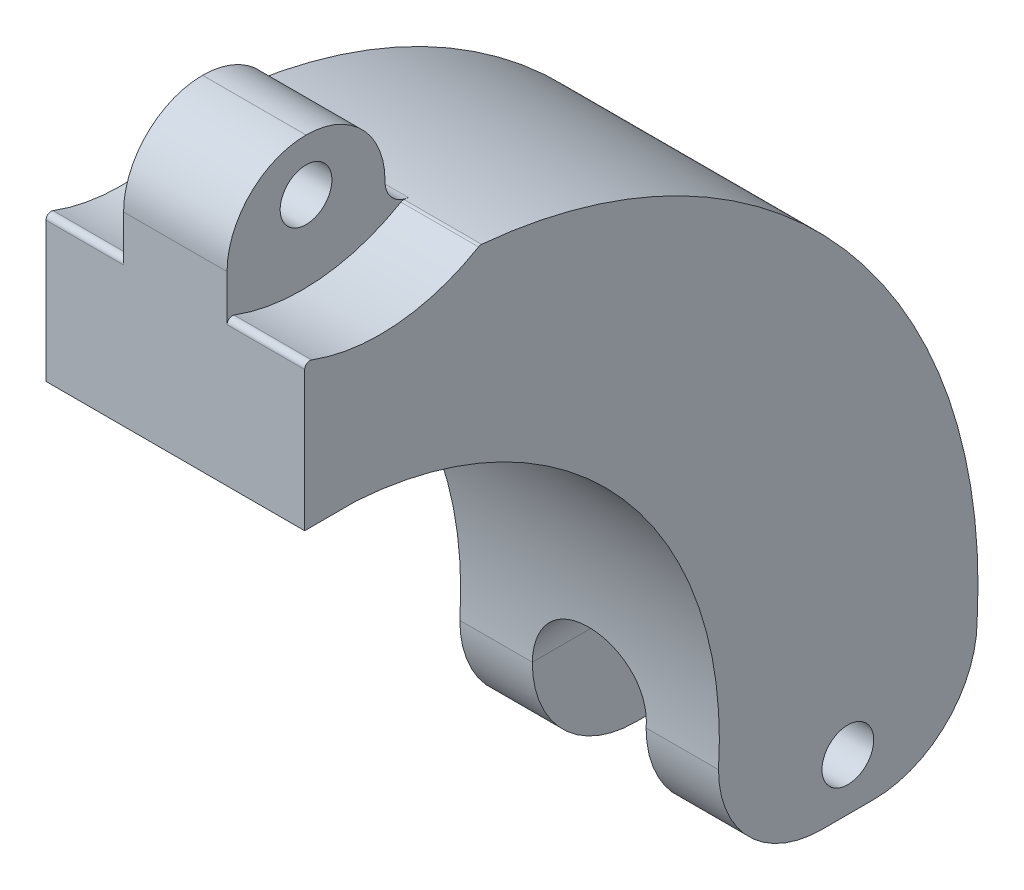
from build123d import *

# Parameters (mm, degrees)
BOSS_EXTRUDE1_DEPTH     = 50
SKETCH3_W               = 22
SKETCH3_H               = 20
CUT_EXTRUDE2_DEPTH      = 192.293252092
CUT_EXTRUDE3_DEPTH      = 158.762822921
CUT_EXTRUDE3_DEPTH_BACK = 158.762822921
SKETCH4_R               = 5
FILLET3_R               = 20
CUT_EXTRUDE4_DEPTH      = 162.533613518
CUT_EXTRUDE4_DEPTH_BACK = 162.533613518
SKETCH6_W               = 20
SKETCH6_H               = 30.53527662
BOSS_EXTRUDE2_DEPTH     = 20
SKETCH7_R               = 5
CUT_EXTRUDE5_DEPTH      = 175.536552167
FILLET4_R               = 15.25
FILLET8_R               = 5
CUT_EXTRUDE7_START      = -15
CUT_EXTRUDE7_DEPTH      = 15
CUT_EXTRUDE8_DEPTH      = 15
FILLET13_R              = 1


with BuildPart() as part:
    # Sketch2 → Boss-Extrude1 (new body)
    with BuildSketch(Plane(origin=(0, 0, 0), x_dir=(0, 0, -1), z_dir=(1, 0, 0))):
        with BuildLine():
            Line((0, 0), (50, 0))
            Line((50, 0), (50, 20))
            ThreePointArc((50, 20), (23.281860252, 96.16106544), (-49.46472338, 131.122493479))
            Line((-49.46472338, 131.122493479), (-80, 131.122493479))
            Line((-80, 131.122493479), (-80, 100))
            Line((-80, 100), (-70, 100))
            ThreePointArc((-70, 100), (-18.431457505, 74.497474683), (0, 20))
            Line((0, 20), (0, 0))
        make_face()
    extrude(amount=BOSS_EXTRUDE1_DEPTH)

    # Sketch3 → Cut-Extrude2 (cut, through all)
    with BuildSketch(Plane(origin=(0, 0, -50), x_dir=(-1, 0, 0), z_dir=(0, 0, -1))):
        with Locations((-25, 10)):
            Rectangle(SKETCH3_W, SKETCH3_H)
    extrude(amount=-CUT_EXTRUDE2_DEPTH, mode=Mode.SUBTRACT)

    # Sketch4 → Cut-Extrude3 (cut, two sides: drawn at the far end of the back side and taken through both)
    with BuildSketch(Plane.ZY.offset(-36).offset(-CUT_EXTRUDE3_DEPTH_BACK)):
        with Locations((-25, 10)):
            Circle(SKETCH4_R)
    extrude(amount=CUT_EXTRUDE3_DEPTH + CUT_EXTRUDE3_DEPTH_BACK, mode=Mode.SUBTRACT)

    # Fillet3
    fillet3_edges = [part.edges().sort_by_distance(p)[0] for p in [
        (7, 0, 0),
        (7, 0, -50),
        (43, 0, 0),
        (43, 0, -50),
    ]]
    fillet(fillet3_edges, radius=FILLET3_R - 0.0001)  # a hair under: the kernel refuses the full size

    # Sketch5 → Cut-Extrude4 (cut, two sides: drawn at the far end of the back side and taken through both)
    with BuildSketch(Plane(origin=(0, 0, 0), x_dir=(-1, 0, 0), z_dir=(0, 0, -1)).offset(-CUT_EXTRUDE4_DEPTH_BACK)):
        with BuildLine():
            Line((-36, 20), (-14, 20))
            ThreePointArc((-14, 20), (-25, 31.439818902), (-36, 20))
        make_face()
    extrude(amount=CUT_EXTRUDE4_DEPTH + CUT_EXTRUDE4_DEPTH_BACK, mode=Mode.SUBTRACT)

    # Sketch6 → Boss-Extrude2 (add)
    with BuildSketch(Plane(origin=(0, 131.122493479, 0), x_dir=(1, 0, 0), z_dir=(0, 1, 0))):
        with Locations((25, -64.73236169)):
            Rectangle(SKETCH6_W, SKETCH6_H)
    extrude(amount=BOSS_EXTRUDE2_DEPTH)

    # Sketch7 → Cut-Extrude5 (cut, through all)
    with BuildSketch(Plane(origin=(35, 0, 0), x_dir=(0, 0, -1), z_dir=(1, 0, 0))):
        with Locations((-64.73236169, 141.122493479)):
            Circle(SKETCH7_R)
    extrude(amount=-CUT_EXTRUDE5_DEPTH, mode=Mode.SUBTRACT)

    # Fillet4
    fillet4_edges = [part.edges().sort_by_distance(p)[0] for p in [
        (25, 151.122493479, 80),
        (25, 151.122493479, 49.46472338),
    ]]
    fillet(fillet4_edges, radius=FILLET4_R)

    # Fillet8
    fillet8_edges = [part.edges().sort_by_distance(p)[0] for p in [
        (25, 131.122493479, 49.46472338),
    ]]
    fillet(fillet8_edges, radius=FILLET8_R)

    # Sketch8 → Cut-Extrude7 (cut)
    with BuildSketch(Plane(origin=(50, 0, 0), x_dir=(0, 0, -1), z_dir=(1, 0, 0)).offset(CUT_EXTRUDE7_START)):
        with BuildLine():
            Line((-80, 128.470495387), (-80, 131.122493479))
            Line((-80, 131.122493479), (-49.46472338, 131.122493479))
            ThreePointArc((-49.46472338, 131.122493479), (-47.791514438, 131.016519602), (-46.120201716, 130.883958636))
            ThreePointArc((-46.120201716, 130.883958636), (-62.771967085, 125.632452712), (-80, 128.470495387))
        make_face()
    extrude(amount=CUT_EXTRUDE7_DEPTH, mode=Mode.SUBTRACT)

    # Sketch9 → Cut-Extrude8 (cut)
    with BuildSketch(Plane.ZY):
        with BuildLine():
            Line((80, 128.467222993), (80, 131.122493479))
            Line((80, 131.122493479), (49.46472338, 131.122493479))
            ThreePointArc((49.46472338, 131.122493479), (47.79280742, 131.016611811), (46.122784424, 130.884184126))
            ThreePointArc((46.122784424, 130.884184126), (62.770455841, 125.597808373), (80, 128.467222993))
        make_face()
    extrude(amount=-CUT_EXTRUDE8_DEPTH, mode=Mode.SUBTRACT)

    # Fillet13
    fillet13_edges = [part.edges().sort_by_distance(p)[0] for p in [
        (42.5, 130.883958636, 46.120201716),
        (42.5, 128.470495387, 80),
        (7.5, 128.467222993, 80),
        (7.5, 130.884184126, 46.122784424),
    ]]
    fillet(fillet13_edges, radius=FILLET13_R)


solid = part.part
